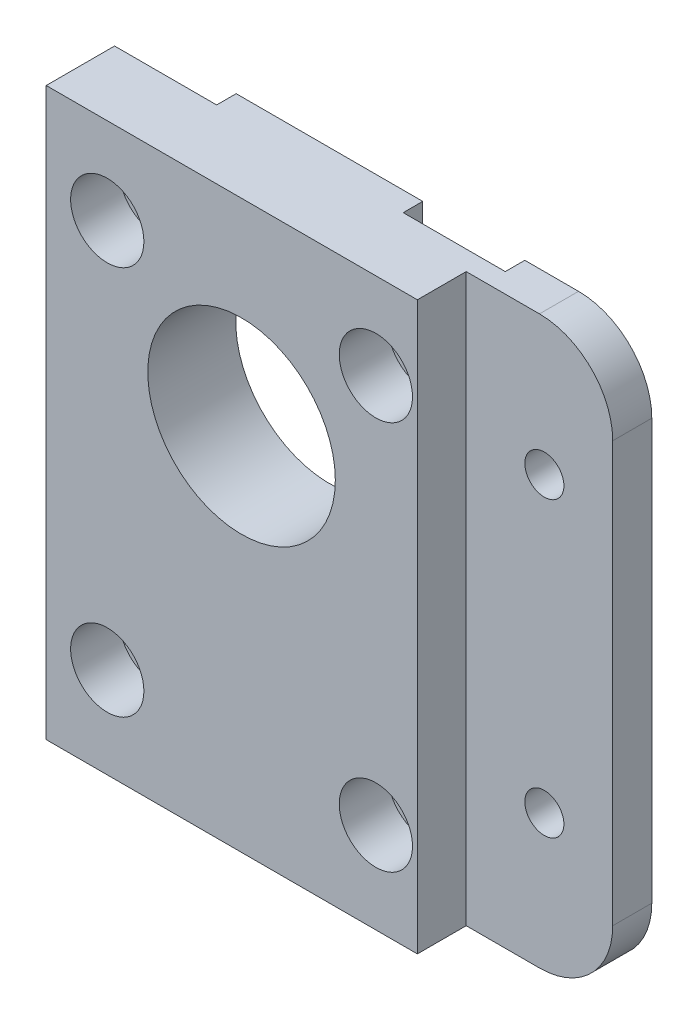
from build123d import *

# Parameters (mm, degrees)
SKETCH1_R           = 4.2
SKETCH1_R_2         = 9.6
BOSS_EXTRUDE1_DEPTH = 2
SKETCH4_W           = 53
SKETCH4_H           = 58
SKETCH4_R           = 2
SKETCH4_R_2         = 9.6
BOSS_EXTRUDE3_DEPTH = 2
SKETCH5_R           = 2
CUT_EXTRUDE1_DEPTH  = 4
SKETCH6_W           = 38
SKETCH6_H           = 58
SKETCH6_R           = 3.75
SKETCH6_R_2         = 9.6
BOSS_EXTRUDE4_DEPTH = 5
CUT_EXTRUDE2_DEPTH  = 45.215381939


with BuildPart() as part:
    # Sketch1 → Boss-Extrude1 (new body)
    with BuildSketch(Plane.XY):
        with BuildLine():
            Line((33, 29), (20, 29))
            Line((20, 29), (20, 21.814655719))
            Line((20, 21.814655719), (17.207493701, 17.765521586))
            ThreePointArc((17.207493701, 17.765521586), (12.50129538, 16.139920603), (9.55, 20.15))
            Line((9.55, 20.15), (9.55, 29))
            Line((9.55, 29), (-9.55, 29))
            Line((-9.55, 29), (-9.55, 20.15))
            ThreePointArc((-9.55, 20.15), (-12.50129538, 16.139920603), (-17.207493701, 17.765521586))
            Line((-17.207493701, 17.765521586), (-20, 21.814655719))
            Line((-20, 21.814655719), (-20, -16.278610808))
            Line((-20, -16.278610808), (-16.186, -16.278610808))
            Line((-16.186, -16.278610808), (-12.112917629, -13.378610808))
            ThreePointArc((-12.112917629, -13.378610808), (-6.255528438, -14.364), (-7.240917629, -20.221389192))
            Line((-7.240917629, -20.221389192), (-11.314, -23.121389192))
            Line((-11.314, -23.121389192), (-11.314, -29))
            Line((-11.314, -29), (9.55, -29))
            Line((9.55, -29), (9.55, -19.7))
            ThreePointArc((9.55, -19.7), (12.50129538, -15.689920603), (17.207493701, -17.315521586))
            Line((17.207493701, -17.315521586), (20, -21.364655719))
            Line((20, -21.364655719), (20, -29))
            Line((20, -29), (33, -29))
            Line((33, -29), (33, 29))
        make_face()
        with Locations((-5.725, -6.1)):
            Circle(SKETCH1_R, mode=Mode.SUBTRACT)
        with Locations((5.725, -6.1)):
            Circle(SKETCH1_R, mode=Mode.SUBTRACT)
        with Locations((0, 8.8)):
            Circle(SKETCH1_R_2, mode=Mode.SUBTRACT)
    extrude(amount=BOSS_EXTRUDE1_DEPTH)

    # Sketch4 → Boss-Extrude3 (add)
    with BuildSketch(Plane.XY.offset(2)):
        with Locations((6.5, 0)):
            Rectangle(SKETCH4_W, SKETCH4_H)
        with Locations((13.75, -19.7)):
            Circle(SKETCH4_R, mode=Mode.SUBTRACT)
        with Locations((-13.75, 20.15)):
            Circle(SKETCH4_R, mode=Mode.SUBTRACT)
        with Locations((13.75, 20.15)):
            Circle(SKETCH4_R, mode=Mode.SUBTRACT)
        with Locations((-13.75, -19.7)):
            Circle(SKETCH4_R, mode=Mode.SUBTRACT)
        with Locations((0, 8.8)):
            Circle(SKETCH4_R_2, mode=Mode.SUBTRACT)
    extrude(amount=BOSS_EXTRUDE3_DEPTH)

    # Sketch5 → Cut-Extrude1 (cut)
    with BuildSketch(Plane.XY.offset(4)):
        with Locations((26, 15)):
            Circle(SKETCH5_R)
        with Locations((26, -15)):
            Circle(SKETCH5_R)
    extrude(amount=-CUT_EXTRUDE1_DEPTH, mode=Mode.SUBTRACT)

    # Sketch6 → Boss-Extrude4 (add)
    with BuildSketch(Plane.XY.offset(4)):
        with Locations((-1, 0)):
            Rectangle(SKETCH6_W, SKETCH6_H)
        with Locations((-13.75, -19.7)):
            Circle(SKETCH6_R, mode=Mode.SUBTRACT)
        with Locations((13.75, -19.7)):
            Circle(SKETCH6_R, mode=Mode.SUBTRACT)
        with Locations((0, 8.8)):
            Circle(SKETCH6_R_2, mode=Mode.SUBTRACT)
        with Locations((-13.75, 20.15)):
            Circle(SKETCH6_R, mode=Mode.SUBTRACT)
        with Locations((13.75, 20.15)):
            Circle(SKETCH6_R, mode=Mode.SUBTRACT)
    extrude(amount=BOSS_EXTRUDE4_DEPTH)

    # Sketch7 → Cut-Extrude2 (cut, through all)
    with BuildSketch(Plane.XY.offset(4)):
        with BuildLine():
            Line((25.5, 29), (33, 29))
            Line((33, 29), (33, 21.5))
            ThreePointArc((33, 21.5), (30.803300859, 26.803300859), (25.5, 29))
        make_face()
        with BuildLine():
            Line((33, -29), (33, -21.5))
            ThreePointArc((33, -21.5), (30.803300859, -26.803300859), (25.5, -29))
            Line((25.5, -29), (33, -29))
        make_face()
    extrude(amount=-CUT_EXTRUDE2_DEPTH, mode=Mode.SUBTRACT)


solid = part.part
